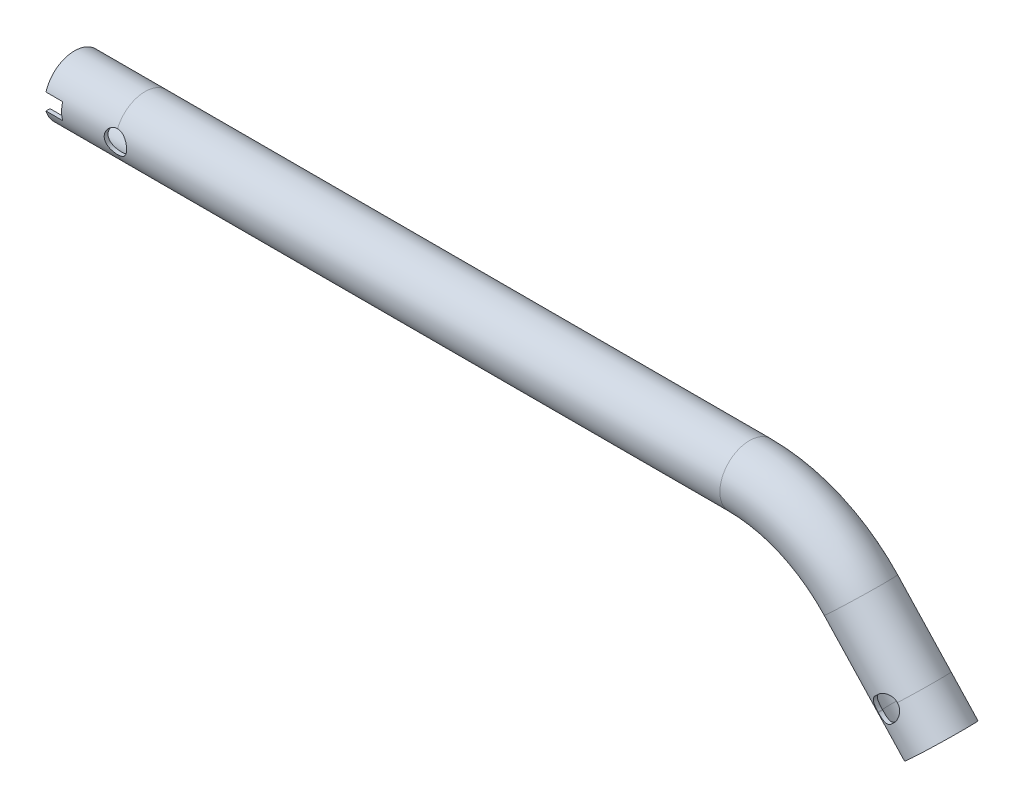
from build123d import *

# Parameters (mm, degrees)
SKETCH2_R                      = 9.25
SKETCH2_R_2                    = 8.05
CUT_EXTRUDE1_REACH             = 261.855
CUT_EXTRUDE1_DIRECTION_2_REACH = 261.855
CUT_EXTRUDE2_REACH             = 261.855
SKETCH4_R                      = 3.5
CUT_EXTRUDE3_DEPTH             = 260.855156689
CUT_EXTRUDE3_DEPTH_BACK        = 260.855156689


with BuildPart() as part:
    # Sweep1: sweep along a path in Sketch1
    with BuildLine(Plane.XY) as sweep1_path:
        Line((-22.007364225, 0), (0, 0))
        Line((0, 0), (188.573414347, 0))
        ThreePointArc((188.573414347, 0), (207.513995121, -3.939646467), (223.312715174, -15.105077897))
        Line((223.312715174, -15.105077897), (240, -33))
        Line((240, -33), (248.392635775, -42))
    # Sketch2 → Sweep1 (sweep)
    with BuildSketch(Plane.ZY.offset(22.007364225)):
        Circle(SKETCH2_R)
        Circle(SKETCH2_R_2, mode=Mode.SUBTRACT)
    sweep(path=sweep1_path.line)

    # Sketch3 → Cut-Extrude1 (cut, up to next)
    with BuildSketch(Plane.XY, mode=Mode.PRIVATE) as cut_extrude1_sk1:
        with BuildLine():
            Line((243.055538772, -30.26491951), (242.941561581, -30.142693937))
            ThreePointArc((242.941561581, -30.142693937), (240.503971864, -29.031820303), (237.994829366, -29.969950242))
            Line((237.994829366, -29.969950242), (237.117204924, -30.788348274))
            ThreePointArc((237.117204924, -30.788348274), (236.006331289, -33.225937991), (236.944461228, -35.73508049))
            Line((236.944461228, -35.73508049), (237.058438419, -35.857306063))
            ThreePointArc((237.058438419, -35.857306063), (239.496028136, -36.968179697), (242.005170634, -36.030049758))
            Line((242.005170634, -36.030049758), (242.882795076, -35.211651726))
            ThreePointArc((242.882795076, -35.211651726), (243.993668711, -32.774062009), (243.055538772, -30.26491951))
        make_face()
    cut_extrude1_tool1 = extrude(cut_extrude1_sk1.sketch, amount=-CUT_EXTRUDE1_REACH, mode=Mode.PRIVATE) & part.part
    add(cut_extrude1_tool1.solids().sort_by_distance((240, -33, 0))[0], mode=Mode.SUBTRACT)

    # Sketch3 → Cut-Extrude1 direction 2 (cut, up to next)
    with BuildSketch(Plane.XY, mode=Mode.PRIVATE) as cut_extrude1_direction_2_sk1:
        with BuildLine():
            Line((243.055538772, -30.26491951), (242.941561581, -30.142693937))
            ThreePointArc((242.941561581, -30.142693937), (240.503971864, -29.031820303), (237.994829366, -29.969950242))
            Line((237.994829366, -29.969950242), (237.117204924, -30.788348274))
            ThreePointArc((237.117204924, -30.788348274), (236.006331289, -33.225937991), (236.944461228, -35.73508049))
            Line((236.944461228, -35.73508049), (237.058438419, -35.857306063))
            ThreePointArc((237.058438419, -35.857306063), (239.496028136, -36.968179697), (242.005170634, -36.030049758))
            Line((242.005170634, -36.030049758), (242.882795076, -35.211651726))
            ThreePointArc((242.882795076, -35.211651726), (243.993668711, -32.774062009), (243.055538772, -30.26491951))
        make_face()
    cut_extrude1_direction_2_tool1 = extrude(cut_extrude1_direction_2_sk1.sketch, amount=CUT_EXTRUDE1_DIRECTION_2_REACH, mode=Mode.PRIVATE) & part.part
    add(cut_extrude1_direction_2_tool1.solids().sort_by_distance((240, -33, 0))[0], mode=Mode.SUBTRACT)

    # Sketch4 → Cut-Extrude2 (cut, up to next)
    with BuildSketch(Plane.XY, mode=Mode.PRIVATE) as cut_extrude2_sk1:
        Circle(SKETCH4_R)
    cut_extrude2_tool1 = extrude(cut_extrude2_sk1.sketch, amount=CUT_EXTRUDE2_REACH, mode=Mode.PRIVATE) & part.part
    add(cut_extrude2_tool1.solids().sort_by_distance((0, 0, 0))[0], mode=Mode.SUBTRACT)

    # Sketch5 → Cut-Extrude3 (cut, two sides: drawn at the far end of the back side and taken through both)
    with BuildSketch(Plane.XY.offset(-CUT_EXTRUDE3_DEPTH_BACK)):
        Polygon((-22.007364225, 0), (-22.007364225, 2.555), (-16.807364225, 2.555), (-16.807364225, -2.555), (-22.007364225, -2.555), align=None)
    extrude(amount=CUT_EXTRUDE3_DEPTH + CUT_EXTRUDE3_DEPTH_BACK, mode=Mode.SUBTRACT)


solid = part.part
